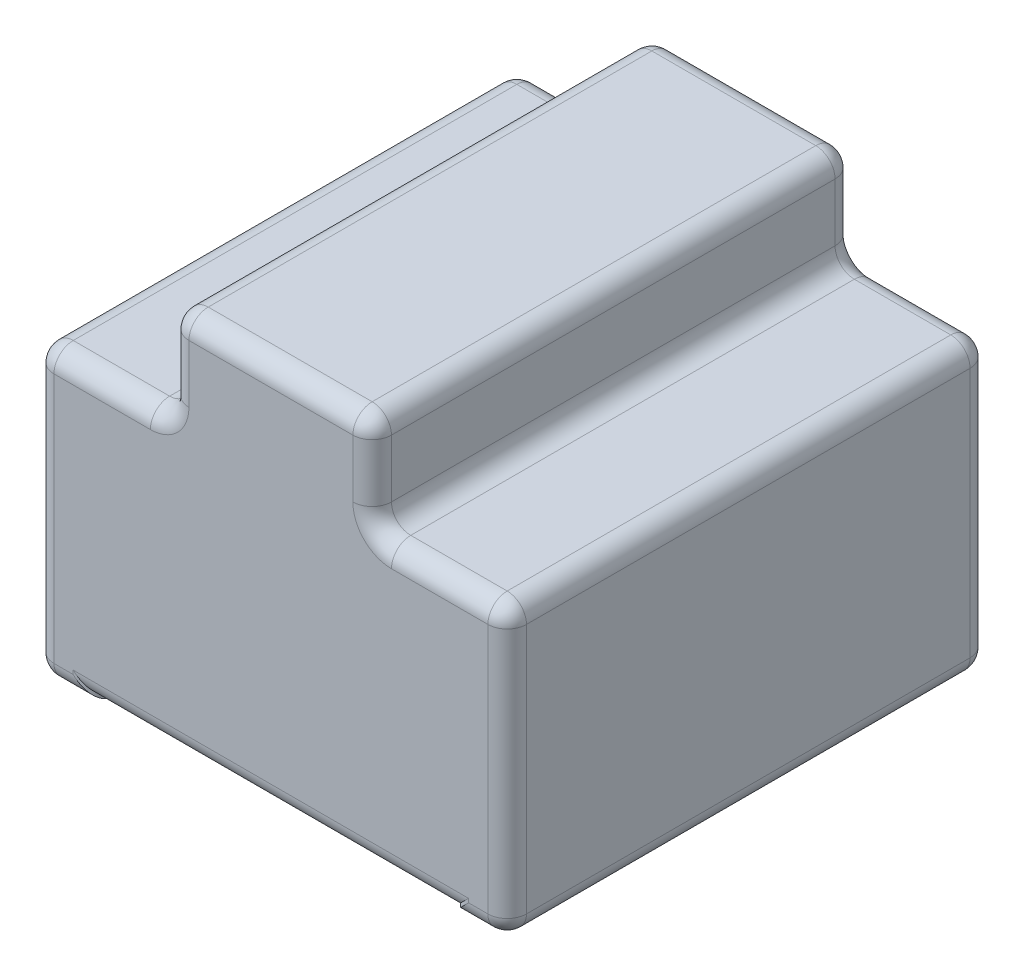
from build123d import *

# Parameters (mm, degrees)
BOSS_EXTRUDE1_DEPTH          = 58.42
SKETCH3_W                    = 41.91
SKETCH3_H                    = 50.8
CUT_EXTRUDE1_DEPTH           = 2.54
SKETCH15_W                   = 41.91
SKETCH15_H                   = 25.4
SKETCH17_W                   = 31.75
SKETCH17_H                   = 27.94
CUT_REVOLVE3_ANGLE           = 230
CUT_REVOLVE3_OTHER_WAY_ANGLE = 20
BOSS_EXTRUDE2_DEPTH          = 2.54
BOSS_EXTRUDE3_DEPTH          = 2.54
CUT_REVOLVE4_ANGLE           = 340
FILLET2_R                    = 2.54


with BuildPart() as part:
    # Sketch2 → Boss-Extrude1 (new body)
    with BuildSketch(Plane.XY):
        Polygon((0, 0), (0, 38.1), (17.78, 38.1), (17.78, 50.8), (44.45, 50.8), (44.45, 38.1), (62.23, 38.1), (62.23, 0), (54.61, 0), (54.61, 0.508), (7.62, 0.508), (7.62, 0), align=None)
    extrude(amount=BOSS_EXTRUDE1_DEPTH)

    # Sketch3 → Cut-Extrude1 (cut)
    with BuildSketch(Plane.XZ.offset(-0.508)):
        with Locations((31.115, 29.21)):
            Rectangle(SKETCH3_W, SKETCH3_H)
    extrude(amount=-CUT_EXTRUDE1_DEPTH, mode=Mode.SUBTRACT)

    # Sketch15 → Cut-Revolve2 (revolve, cut)
    with BuildSketch(Plane(origin=(0, 0.508, 0), x_dir=(-1, 0, 0), z_dir=(0, -1, 0))):
        with Locations((-31.115, -41.91)):
            Rectangle(SKETCH15_W, SKETCH15_H)
    revolve(axis=Axis((52.07, 0.508, 29.21), (-1, 0, 0)), mode=Mode.SUBTRACT)

    # Sketch17 → Cut-Revolve3 (revolve, cut)
    with BuildSketch(Plane.XZ.offset(-0.508)):
        with Locations((31.115, 15.24)):
            Rectangle(SKETCH17_W, SKETCH17_H)
    revolve(axis=Axis((46.99, 0.508, 29.21), (-1, 0, 0)), revolution_arc=CUT_REVOLVE3_ANGLE, mode=Mode.SUBTRACT)

    # Sketch17 → Cut-Revolve3 other way (revolve, cut)
    with BuildSketch(Plane.XZ.offset(-0.508)):
        with Locations((31.115, 15.24)):
            Rectangle(SKETCH17_W, SKETCH17_H)
    revolve(axis=Axis((46.99, 0.508, 29.21), (1, 0, 0)), revolution_arc=CUT_REVOLVE3_OTHER_WAY_ANGLE, mode=Mode.SUBTRACT)

    # Sketch19 → Boss-Extrude2 (add)
    with BuildSketch(Plane(origin=(0, 0, 0), x_dir=(-1, 0, 0), z_dir=(0, 0, -1))):
        Polygon((-7.62, 0), (0, 0), (0, 38.1), (-17.78, 38.1), (-17.78, 50.8), (-44.45, 50.8), (-44.45, 38.1), (-62.23, 38.1), (-62.23, 0), (-54.61, 0), (-54.61, 0.508), (-7.62, 0.508), align=None)
    extrude(amount=BOSS_EXTRUDE2_DEPTH)

    # Sketch20 → Boss-Extrude3 (add)
    with BuildSketch(Plane.XY.offset(58.42)):
        Polygon((0, 0), (7.62, 0), (7.62, 0.508), (54.61, 0.508), (54.61, 0), (62.23, 0), (62.23, 38.1), (44.45, 38.1), (44.45, 50.8), (17.78, 50.8), (17.78, 38.1), (0, 38.1), align=None)
    extrude(amount=BOSS_EXTRUDE3_DEPTH)

    # Sketch18 → Cut-Revolve4 (revolve, cut)
    with BuildSketch(Plane.XZ.offset(-0.508)):
        Polygon((46.99, 29.21), (52.07, 29.21), (52.07, 44.196), (54.61, 44.196), (54.61, 47.752), (46.99, 47.752), align=None)
        Polygon((15.24, 47.752), (7.62, 47.752), (7.62, 44.196), (10.16, 44.196), (10.16, 29.21), (15.24, 29.21), align=None)
    revolve(axis=Axis((10.16, 0.508, 29.21), (1, 0, 0)), revolution_arc=CUT_REVOLVE4_ANGLE, mode=Mode.SUBTRACT)

    # Fillet2
    fillet2_edges = [part.edges().sort_by_distance(p)[0] for p in [
        (62.23, 0, 29.21),
        (62.23, 38.1, 29.21),
        (44.45, 38.1, 29.21),
        (0, 0, 29.21),
        (0, 38.1, 29.21),
        (17.78, 38.1, 29.21),
        (44.45, 50.8, 29.21),
        (17.78, 50.8, 29.21),
        (53.34, 38.1, 60.96),
        (53.34, 38.1, -2.54),
        (62.23, 19.05, 60.96),
        (62.23, 19.05, -2.54),
        (44.45, 44.45, 60.96),
        (44.45, 44.45, -2.54),
        (0, 19.05, 60.96),
        (0, 19.05, -2.54),
        (8.89, 38.1, 60.96),
        (8.89, 38.1, -2.54),
        (17.78, 44.45, 60.96),
        (17.78, 44.45, -2.54),
        (31.115, 50.8, 60.96),
        (31.115, 50.8, -2.54),
        (58.42, 0, -2.54),
        (54.61, 0.254, -2.54),
        (31.115, 0.508, -2.54),
        (7.62, 0.254, -2.54),
        (3.81, 0, -2.54),
        (54.61, 0.254, 60.96),
        (3.81, 0, 60.96),
        (7.62, 0.254, 60.96),
        (31.115, 0.508, 60.96),
        (58.42, 0, 60.96),
    ]]
    fillet(fillet2_edges, radius=FILLET2_R)


solid = part.part
